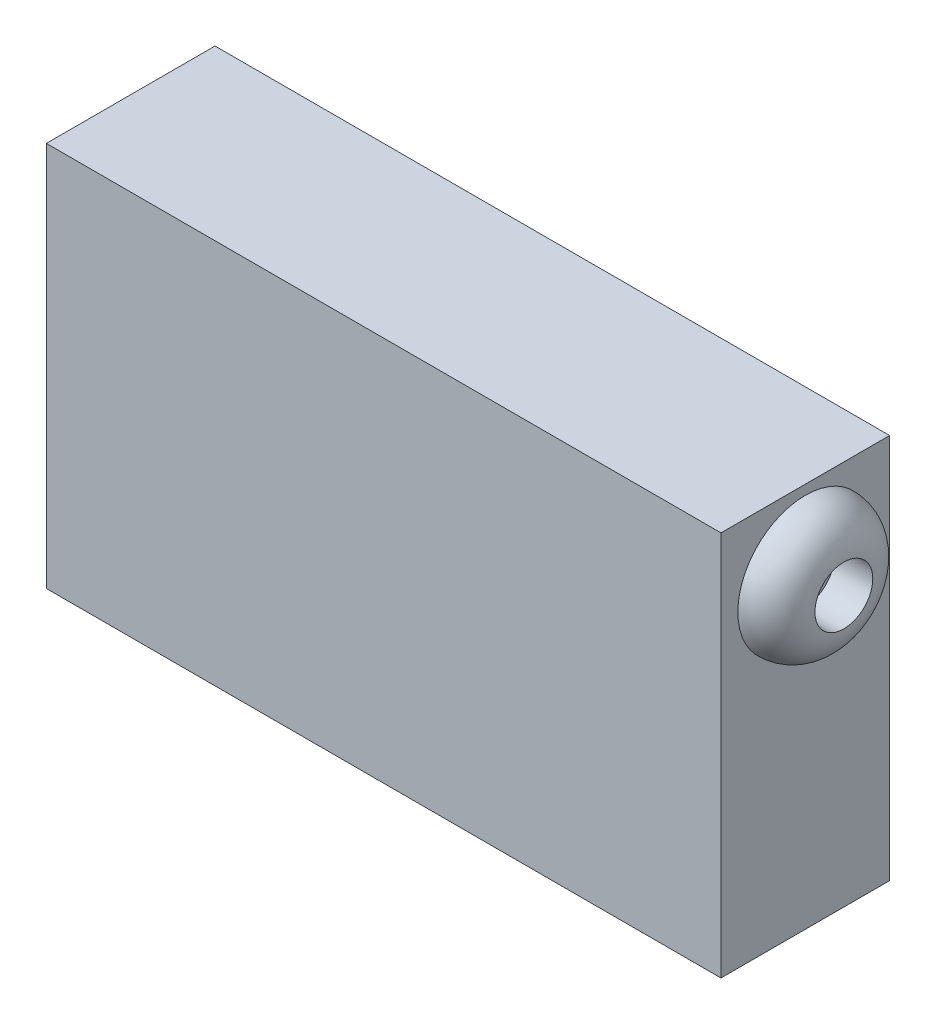
from build123d import *

# Parameters (mm, degrees)
SKETCH1_W           = 35
SKETCH1_H           = 8.75
BOSS_EXTRUDE1_DEPTH = 20
SKETCH2_R           = 3.5
BOSS_EXTRUDE2_DEPTH = 2
SKETCH3_R           = 1.5
CUT_EXTRUDE1_DEPTH  = 2
FILLET1_R           = 2


with BuildPart() as part:
    # Sketch1 → Boss-Extrude1 (new body)
    with BuildSketch(Plane(origin=(0, 0, 0), x_dir=(1, 0, 0), z_dir=(0, 1, 0))):
        Rectangle(SKETCH1_W, SKETCH1_H)
    extrude(amount=BOSS_EXTRUDE1_DEPTH)

    # Sketch2 → Boss-Extrude2 (add)
    with BuildSketch(Plane(origin=(17.5, 0, 0), x_dir=(0, 0, -1), z_dir=(1, 0, 0))):
        with Locations(Location((0, 16, 0), (0, 0, 180))):
            Circle(SKETCH2_R)
    extrude(amount=BOSS_EXTRUDE2_DEPTH)

    # Sketch3 → Cut-Extrude1 (cut)
    with BuildSketch(Plane(origin=(19.5, 0, 0), x_dir=(0, 0, -1), z_dir=(1, 0, 0))):
        with Locations((0, 16)):
            Circle(SKETCH3_R)
    extrude(amount=-CUT_EXTRUDE1_DEPTH, mode=Mode.SUBTRACT)

    # Fillet1
    fillet1_edges = [part.edges().sort_by_distance(p)[0] for p in [
        (19.5, 16, -3.5),
    ]]
    fillet(fillet1_edges, radius=FILLET1_R - 0.0001)  # a hair under: the kernel refuses the full size


solid = part.part
